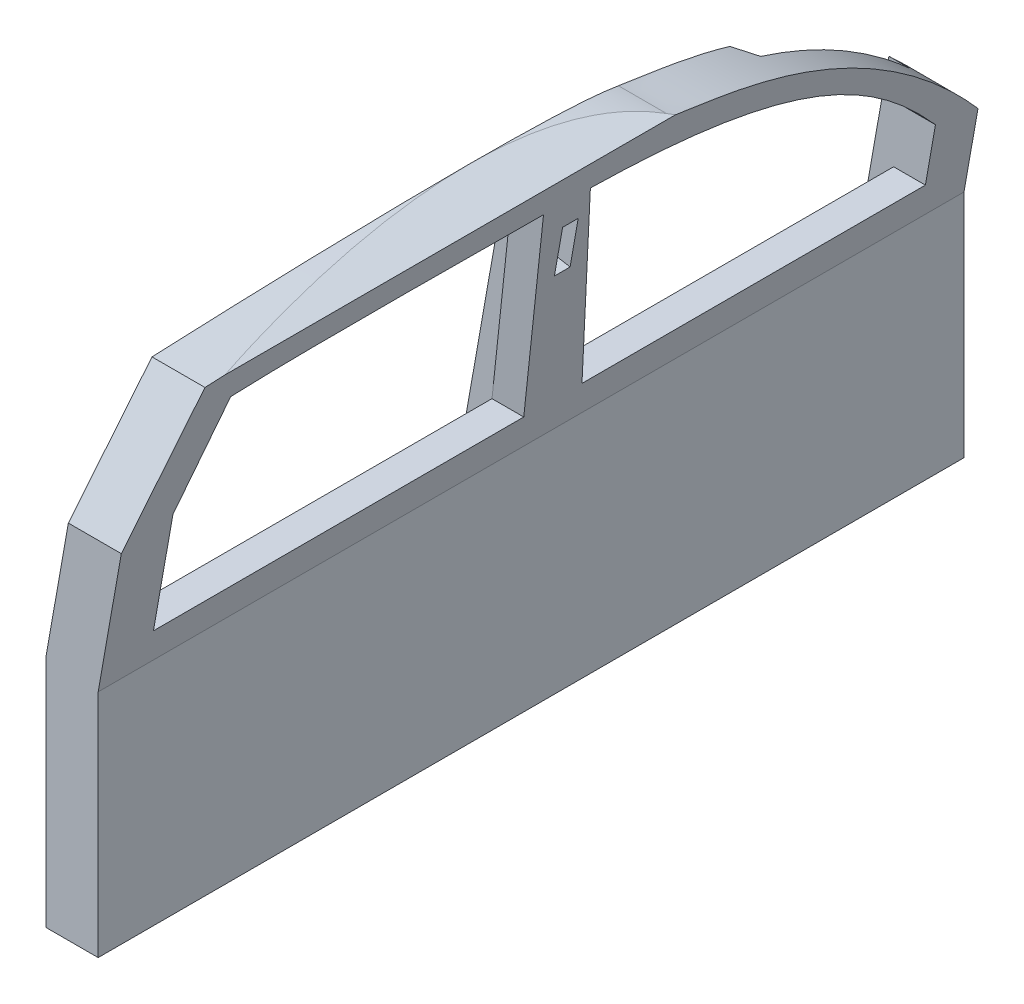
from build123d import *

# Parameters (mm, degrees)
EXTRUDE_1_DEPTH          = 300
CUT_EXTRUDE_1_DEPTH      = 939.357588719
CUT_EXTRUDE_1_DEPTH_BACK = 939.357588719
SKETCH_4_W               = 15
SKETCH_4_H               = 45
CUT_EXTRUDE_2_DEPTH      = 846.285829165
SKETCH_4_4_W             = 355
SKETCH_4_4_H             = 220.385665297
CUT_EXTRUDE_3_DEPTH      = 20


with BuildPart() as part:
    # 스케치1 → 보스-돌출1 (new body)
    with BuildSketch(Plane(origin=(0, 0, 0), x_dir=(0, 0, -1), z_dir=(1, 0, 0))):
        with BuildLine():
            Line((-43.681754967, 27.705085546), (-43.681754967, -318.771021293))
            Line((-43.681754967, -318.771021293), (786.318245033, -318.771021293))
            Line((786.318245033, -318.771021293), (786.318245033, -22.084327893))
            add(Edge.make_bspline(
                [(786.318245033, -22.084327893), (649.945018949, 130.004301947), (517.544972774, 136.99620254), (462.352071782, 148.350361269)],
                knots=[0, 0, 0, 0, 1, 1, 1, 1], degree=3))
            add(Edge.make_bspline(
                [(15.559916007, 146.513441429), (105.223881109, 151.526168955), (383.055762225, 164.567775718), (462.352071782, 148.350361269)],
                knots=[0, 0, 0, 0, 1, 1, 1, 1], degree=3))
            Line((15.559916007, 146.513441429), (-43.681754967, 27.705085546))
        make_face()
        with BuildLine():
            Line((4.116595834, 37.205342392), (44.461628647, 122.281682792))
            add(Edge.make_bspline(
                [(44.461628647, 122.281682792), (113.063923635, 125.96681728), (252.321866472, 124.405754947), (344.130352278, 123.597907092)],
                knots=[0, 0, 0, 0, 0.845057475, 0.845057475, 0.845057475, 0.845057475], degree=3))
            Line((344.130352278, 123.597907092), (359.116595834, -68.771021293))
            Line((359.116595834, -68.771021293), (4.116595834, -68.771021293))
            Line((4.116595834, -68.771021293), (4.116595834, 37.205342392))
        make_face(mode=Mode.SUBTRACT)
        with BuildLine():
            Line((414.932922958, -68.771021293), (389.116595834, 123.266490545))
            add(Edge.make_bspline(
                [(389.116595834, 123.266490545), (584.597474826, 118.836091376), (668.447748965, 69.762042421), (744.116595834, -13.771021293)],
                knots=[0.027735734, 0.027735734, 0.027735734, 0.027735734, 0.842070206, 0.842070206, 0.842070206, 0.842070206], degree=3))
            Line((744.116595834, -13.771021293), (744.116595834, -68.771021293))
            Line((744.116595834, -68.771021293), (414.932922958, -68.771021293))
        make_face(mode=Mode.SUBTRACT)
    extrude(amount=EXTRUDE_1_DEPTH)

    # 스케치2 → 컷-돌출1 (cut, two sides: drawn at the far end of the back side and taken through both)
    with BuildSketch(Plane.XY.offset(43.681754967).offset(-CUT_EXTRUDE_1_DEPTH_BACK)):
        Polygon((139.399465467, 156.228978707), (188.639853118, 147.546569824), (145.31772029, -98.145454469), (145.31772029, -318.771021293), (341.364714008, -318.771021293), (341.364714008, 251.457374482), (0, 251.457374482), (0, -318.771021293), (95.31772029, -318.771021293), (95.31772029, -93.771021293), align=None)
    extrude(amount=CUT_EXTRUDE_1_DEPTH + CUT_EXTRUDE_1_DEPTH_BACK, mode=Mode.SUBTRACT)

    # 스케치4 → 컷-돌출2 (cut, through all)
    with BuildSketch(Plane(origin=(108.47932841, -19.127832448, 0), x_dir=(0, 0, 1), z_dir=(-0.9848077530122081, 0.17364817766693066, 0))):
        with Locations((-374.116595834, 107.090984948)):
            Rectangle(SKETCH_4_W, SKETCH_4_H)
    extrude(amount=-CUT_EXTRUDE_2_DEPTH, mode=Mode.SUBTRACT)

    # 스케치4<4> → 컷-돌출3 (cut)
    with BuildSketch(Plane(origin=(108.47932841, -19.127832448, 0), x_dir=(0, 0, 1), z_dir=(-0.9848077530122081, 0.17364817766693066, 0))):
        Polygon((-359.116595834, -75.794680349), (-4.116595834, -75.794680349), (-4.116595834, 57.202204864), (-4.116595834, 144.590984948), (-359.116595834, 144.590984948), align=None)
        with Locations((-566.616595834, 34.398152299)):
            Rectangle(SKETCH_4_4_W, SKETCH_4_4_H)
    extrude(amount=-CUT_EXTRUDE_3_DEPTH, mode=Mode.SUBTRACT)


solid = part.part
